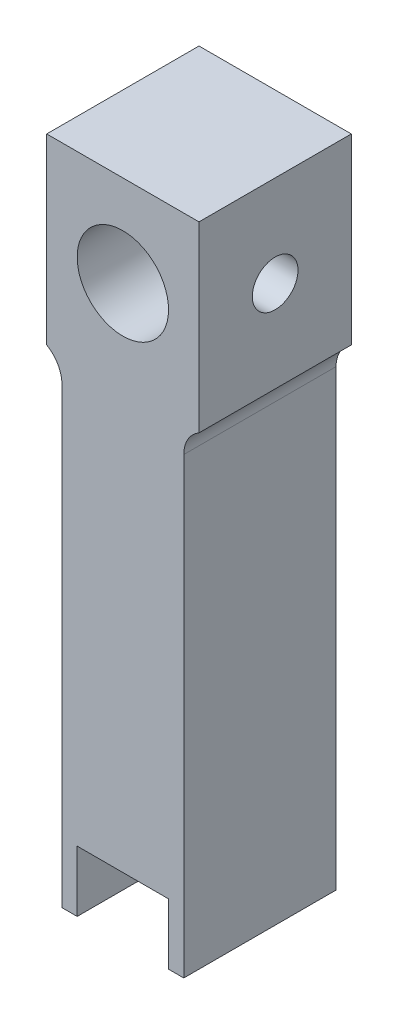
from build123d import *

# Parameters (mm, degrees)
SKETCH1_W           = 10
SKETCH1_H           = 12
SKETCH1_R           = 3
BOSS_EXTRUDE1_DEPTH = 10
SKETCH2_R           = 1.5
CUT_EXTRUDE1_DEPTH  = 41.078048855
FILLET1_R           = 2


with BuildPart() as part:
    # Sketch1 → Boss-Extrude1 (new body)
    # profile 1 of 2: a face of its own
    with BuildSketch(Plane.XY):
        Rectangle(SKETCH1_W, SKETCH1_H)
        Circle(SKETCH1_R, mode=Mode.SUBTRACT)
    # profile 2 of 2: a face of its own
    with BuildSketch(Plane.XY):
        Polygon((-4, -6), (4, -6), (4, -37.5), (3, -37.5), (3, -33.5), (-3, -33.5), (-3, -37.5), (-4, -37.5), align=None)
    extrude(amount=BOSS_EXTRUDE1_DEPTH)

    # Sketch2 → Cut-Extrude1 (cut, through all)
    with BuildSketch(Plane.ZY.offset(5)):
        with Locations(Location((5, 0, 0), (0, 0, 270))):
            Circle(SKETCH2_R)
    extrude(amount=-CUT_EXTRUDE1_DEPTH, mode=Mode.SUBTRACT)

    # Fillet1
    # the kernel refuses this fillet: 2 mm, written as the material it adds along each edge
    with BuildSketch(Plane(origin=(4, -6, 0), x_dir=(1, 0, 0), z_dir=(0, 0, 1))) as fillet1_piece_1:
        with BuildLine():
            CenterArc((2, -1.732050808), FILLET1_R, 120, 60)
            Line((0, -1.732050808), (-0.04, -1.732050808))
            Line((-0.04, -1.732050808), (-0.04, 0))
            Line((-0.04, 0), (0, 0.04))
            ThreePointArc((0, 0.04), (0.5, 0.04), (0.98, 0.034641016))
            Line((0.98, 0.034641016), (1, 0))
        make_face()
    extrude(amount=10)
    with BuildSketch(Plane(origin=(-4, -6, 0), x_dir=(-1, 0, 0), z_dir=(0, 0, 1))) as fillet1_piece_2:
        with BuildLine():
            CenterArc((2, 1.732050808), FILLET1_R, 180, 60)
            Line((0, 1.732050808), (-0.04, 1.732050808))
            Line((-0.04, 1.732050808), (-0.04, 0))
            Line((-0.04, 0), (0, -0.04))
            ThreePointArc((0, -0.04), (0.5, -0.04), (0.98, -0.034641016))
            Line((0.98, -0.034641016), (1, 0))
        make_face()
    extrude(amount=10)


solid = part.part
